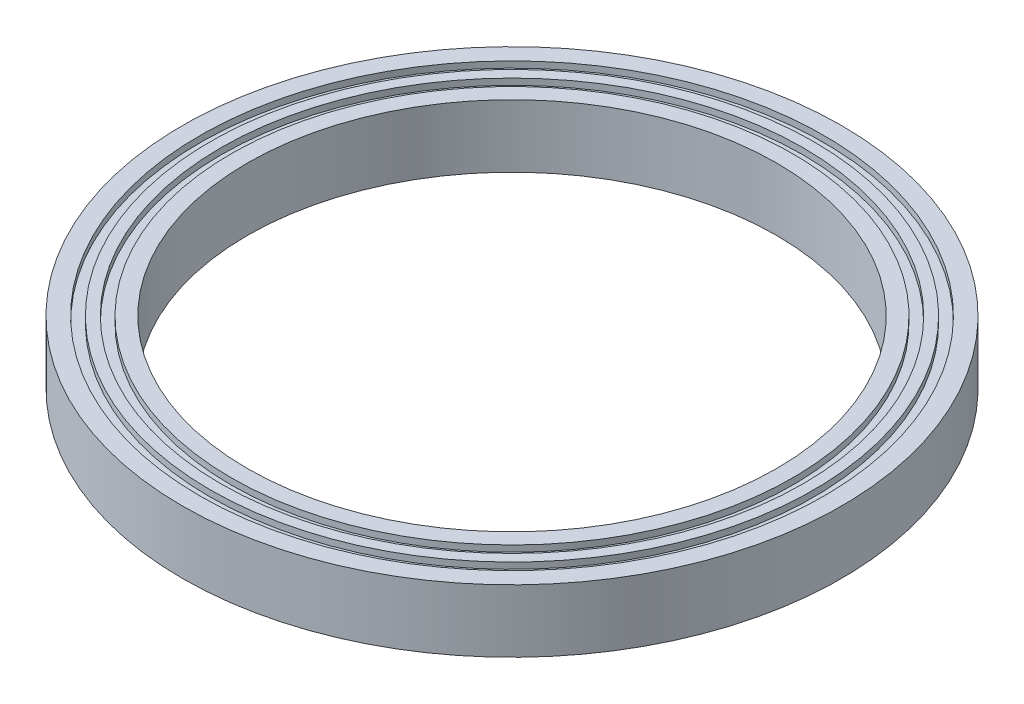
from build123d import *

# Parameters (mm, degrees)
SKETCH1_R           = 9945
SKETCH1_R_2         = 8945
BOSS_EXTRUDE1_DEPTH = 600
SKETCH2_R           = 9945
SKETCH2_R_2         = 8890
BOSS_EXTRUDE5_DEPTH = 1000
SKETCH3_R           = 9275
SKETCH3_R_2         = 8945
CUT_EXTRUDE1_DEPTH  = 200
SKETCH4_R           = 9945
SKETCH4_R_2         = 9611.5
CUT_EXTRUDE2_DEPTH  = 200
SKETCH5_R           = 10500
SKETCH5_R_2         = 9945
BOSS_EXTRUDE6_DEPTH = 1000
SKETCH6_R           = 8890
SKETCH6_R_2         = 8431.002493984
BOSS_EXTRUDE7_DEPTH = 1000
SKETCH7_R           = 9945
SKETCH7_R_2         = 8945
CUT_EXTRUDE3_DEPTH  = 1000


with BuildPart() as part:
    # Sketch1 → Boss-Extrude1 (new body)
    with BuildSketch(Plane(origin=(0, 0, 0), x_dir=(1, 0, 0), z_dir=(0, 1, 0))):
        Circle(SKETCH1_R)
        Circle(SKETCH1_R_2, mode=Mode.SUBTRACT)
    extrude(amount=BOSS_EXTRUDE1_DEPTH)

    # Sketch2 → Boss-Extrude5 (add, symmetric)
    with BuildSketch(Plane(origin=(0, 0, 0), x_dir=(1, 0, 0), z_dir=(0, 1, 0))):
        Circle(SKETCH2_R)
        Circle(SKETCH2_R_2, mode=Mode.SUBTRACT)
    extrude(amount=BOSS_EXTRUDE5_DEPTH, both=True)

    # Sketch3 → Cut-Extrude1 (cut)
    with BuildSketch(Plane(origin=(0, 1000, 0), x_dir=(1, 0, 0), z_dir=(0, 1, 0))):
        Circle(SKETCH3_R)
        Circle(SKETCH3_R_2, mode=Mode.SUBTRACT)
    extrude(amount=-CUT_EXTRUDE1_DEPTH, mode=Mode.SUBTRACT)

    # Sketch4 → Cut-Extrude2 (cut)
    with BuildSketch(Plane(origin=(0, 1000, 0), x_dir=(1, 0, 0), z_dir=(0, 1, 0))):
        Circle(SKETCH4_R)
        Circle(SKETCH4_R_2, mode=Mode.SUBTRACT)
    extrude(amount=-CUT_EXTRUDE2_DEPTH, mode=Mode.SUBTRACT)

    # Sketch5 → Boss-Extrude6 (add, symmetric)
    with BuildSketch(Plane(origin=(0, 0, 0), x_dir=(1, 0, 0), z_dir=(0, 1, 0))):
        Circle(SKETCH5_R)
        Circle(SKETCH5_R_2, mode=Mode.SUBTRACT)
    extrude(amount=BOSS_EXTRUDE6_DEPTH, both=True)

    # Sketch6 → Boss-Extrude7 (add, symmetric)
    with BuildSketch(Plane(origin=(0, 0, 0), x_dir=(1, 0, 0), z_dir=(0, 1, 0))):
        Circle(SKETCH6_R)
        Circle(SKETCH6_R_2, mode=Mode.SUBTRACT)
    extrude(amount=BOSS_EXTRUDE7_DEPTH, both=True)

    # Sketch7 → Cut-Extrude3 (cut)
    with BuildSketch(Plane.XZ.offset(1000)):
        Circle(SKETCH7_R)
        Circle(SKETCH7_R_2, mode=Mode.SUBTRACT)
    extrude(amount=-CUT_EXTRUDE3_DEPTH, mode=Mode.SUBTRACT)


solid = part.part
